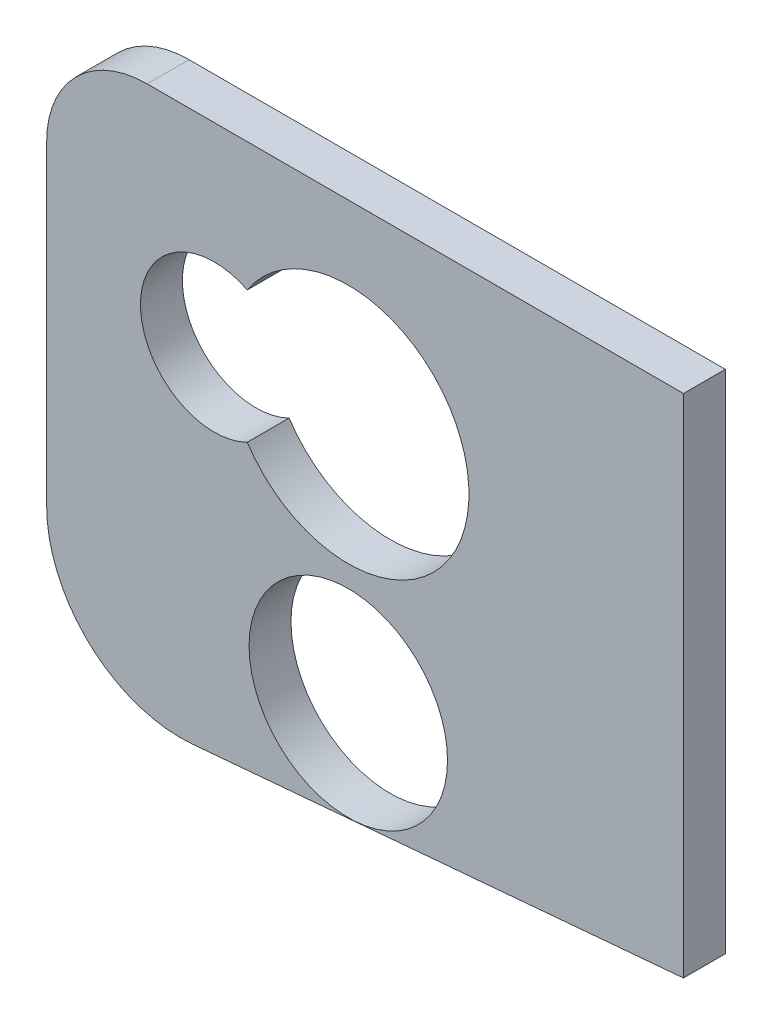
from build123d import *

# Parameters (mm, degrees)
SKETCH1_R           = 3.7592
BOSS_EXTRUDE1_DEPTH = 1.5875


with BuildPart() as part:
    # Sketch1 → Boss-Extrude1 (new body)
    with BuildSketch(Plane.XY):
        with BuildLine():
            Line((12.7, 16.51), (-7.62, 16.51))
            ThreePointArc((-7.62, 16.51), (-10.314076836, 15.394076836), (-11.43, 12.7))
            Line((-11.43, 12.7), (-11.43, 0.762498748))
            ThreePointArc((-11.43, 0.762498748), (-9.781998255, -2.982870123), (-5.907248827, -4.298170318))
            Line((-5.907248827, -4.298170318), (12.7, -2.670246987))
            Line((12.7, -2.670246987), (12.7, 16.51))
        make_face()
        Circle(SKETCH1_R, mode=Mode.SUBTRACT)
        with BuildLine():
            ThreePointArc((-3.82905, 6.645688551), (4.572, 9.144), (-3.82905, 11.642311449))
            ThreePointArc((-3.82905, 11.642311449), (-7.874, 9.144), (-3.82905, 6.645688551))
        make_face(mode=Mode.SUBTRACT)
    extrude(amount=BOSS_EXTRUDE1_DEPTH)


solid = part.part
